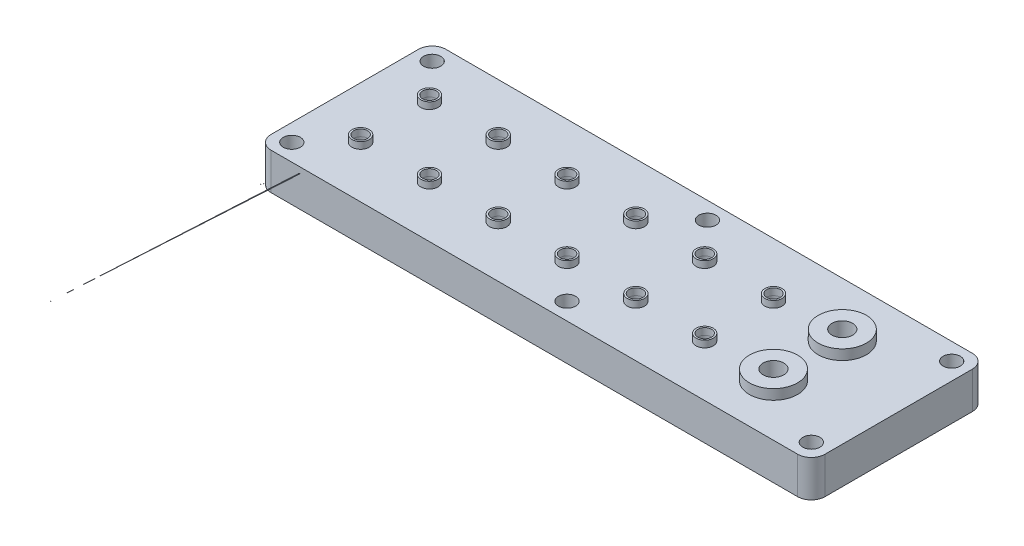
from build123d import *

# Parameters (mm, degrees)
SKETCH1_W                 = 161
SKETCH1_H                 = 50.8
BOSS_EXTRUDE1_DEPTH       = 10.7
CUT_EXTRUDE2_DEPTH        = 1.45
CUT_EXTRUDE2_DEPTH_BACK   = 170.163027875
SKETCH2_R                 = 2
CUT_EXTRUDE3_DEPTH        = 3.5
SKETCH4_R                 = 2.5
SKETCH4_R_2               = 6.99826734
SKETCH4_R_3               = 7
BOSS_EXTRUDE5_DEPTH       = 1.95
SKETCH6_R                 = 2
CUT_EXTRUDE5_DEPTH        = 1.95
CUT_EXTRUDE7_DEPTH        = 3.22
FILLET1_R                 = 4
F_5_0MM_DOWEL_HOLE1_D     = 5
SKETCH10_R                = 7
SKETCH10_R_2              = 6.99826734
BOSS_EXTRUDE6_DEPTH       = 1
F_6_0MM_DOWEL_HOLE1_D     = 6
F_6_0MM_DOWEL_HOLE1_DEPTH = 7
F_6_0MM_DOWEL_HOLE1_TIP   = 1.802581857


with BuildPart() as part:
    # Sketch1 → Boss-Extrude1 (new body)
    with BuildSketch(Plane(origin=(0, 0, 0), x_dir=(1, 0, 0), z_dir=(0, 1, 0))):
        with Locations((80.5, 25.4)):
            Rectangle(SKETCH1_W, SKETCH1_H)
    extrude(amount=BOSS_EXTRUDE1_DEPTH)

    # Sketch2 → Cut-Extrude2 (cut, two sides: drawn at the far end of the back side and taken through both)
    with BuildSketch(Plane(origin=(0, 10.7, 0), x_dir=(1, 0, 0), z_dir=(0, 1, 0)).offset(-CUT_EXTRUDE2_DEPTH_BACK)):
        with Locations((15, 15)):
            Circle(SKETCH2_R)
        with Locations((15, 35)):
            Circle(SKETCH2_R)
        with Locations((35, 15)):
            Circle(SKETCH2_R)
        with Locations((35, 35)):
            Circle(SKETCH2_R)
        with Locations((55, 35)):
            Circle(SKETCH2_R)
        with Locations((55, 15)):
            Circle(SKETCH2_R)
        with Locations((75, 35)):
            Circle(SKETCH2_R)
        with Locations((75, 15)):
            Circle(SKETCH2_R)
        with Locations((95, 35)):
            Circle(SKETCH2_R)
        with Locations((95, 15)):
            Circle(SKETCH2_R)
        with Locations((115, 35)):
            Circle(SKETCH2_R)
        with Locations((115, 15)):
            Circle(SKETCH2_R)
        with Locations((135, 35)):
            Circle(SKETCH2_R)
        with Locations((135, 15)):
            Circle(SKETCH2_R)
    extrude(amount=CUT_EXTRUDE2_DEPTH + CUT_EXTRUDE2_DEPTH_BACK, mode=Mode.SUBTRACT)

    # Sketch3 → Cut-Extrude3 (cut)
    with BuildSketch(Plane(origin=(0, 0, 0), x_dir=(-1, 0, 0), z_dir=(0, -1, 0))):
        with BuildLine():
            Line((-14.5, 12.5), (-135.5, 12.5))
            ThreePointArc((-135.5, 12.5), (-136.914213562, 13.085786438), (-137.5, 14.5))
            Line((-137.5, 14.5), (-137.5, 15.5))
            ThreePointArc((-137.5, 15.5), (-136.914213562, 16.914213562), (-135.5, 17.5))
            Line((-135.5, 17.5), (-14.5, 17.5))
            ThreePointArc((-14.5, 17.5), (-13.085786438, 16.914213562), (-12.5, 15.5))
            Line((-12.5, 15.5), (-12.5, 14.5))
            ThreePointArc((-12.5, 14.5), (-13.085786438, 13.085786438), (-14.5, 12.5))
        make_face()
        with BuildLine():
            Line((-14.5, 32.5), (-135.5, 32.5))
            ThreePointArc((-135.5, 32.5), (-136.914213562, 33.085786438), (-137.5, 34.5))
            Line((-137.5, 34.5), (-137.5, 35.5))
            ThreePointArc((-137.5, 35.5), (-136.914213562, 36.914213562), (-135.5, 37.5))
            Line((-135.5, 37.5), (-14.5, 37.5))
            ThreePointArc((-14.5, 37.5), (-13.085786438, 36.914213562), (-12.5, 35.5))
            Line((-12.5, 35.5), (-12.5, 34.5))
            ThreePointArc((-12.5, 34.5), (-13.085786438, 33.085786438), (-14.5, 32.5))
        make_face()
    extrude(amount=-CUT_EXTRUDE3_DEPTH, mode=Mode.SUBTRACT)

    # Sketch4 → Boss-Extrude5 (add)
    with BuildSketch(Plane(origin=(0, 10.7, 0), x_dir=(1, 0, 0), z_dir=(0, 1, 0))):
        with Locations((15, 35)):
            Circle(SKETCH4_R)
        with Locations((15, 15)):
            Circle(SKETCH4_R)
        with Locations((35, 35)):
            Circle(SKETCH4_R)
        with Locations((35, 15)):
            Circle(SKETCH4_R)
        with Locations((55, 35)):
            Circle(SKETCH4_R)
        with Locations((55, 15)):
            Circle(SKETCH4_R)
        with Locations((75, 35)):
            Circle(SKETCH4_R)
        with Locations((75, 15)):
            Circle(SKETCH4_R)
        with Locations((95, 35)):
            Circle(SKETCH4_R)
        with Locations((115, 15)):
            Circle(SKETCH4_R)
        with Locations((115, 35)):
            Circle(SKETCH4_R)
        with Locations((95, 15)):
            Circle(SKETCH4_R)
        with Locations((135, 15)):
            Circle(SKETCH4_R_2)
        with Locations((135, 35)):
            Circle(SKETCH4_R_3)
    extrude(amount=BOSS_EXTRUDE5_DEPTH)

    # Sketch6 → Cut-Extrude5 (cut)
    with BuildSketch(Plane(origin=(0, 12.65, 0), x_dir=(1, 0, 0), z_dir=(0, 1, 0))):
        with Locations((15.011898474, 14.996675956)):
            Circle(SKETCH6_R)
        with Locations((15.011898474, 34.996675956)):
            Circle(SKETCH6_R)
        with Locations((35.011898474, 14.996675956)):
            Circle(SKETCH6_R)
        with Locations((35.011898474, 34.996675956)):
            Circle(SKETCH6_R)
        with Locations((55.011898474, 34.996675956)):
            Circle(SKETCH6_R)
        with Locations((55.011898474, 14.996675956)):
            Circle(SKETCH6_R)
        with Locations((75.011898474, 34.996675956)):
            Circle(SKETCH6_R)
        with Locations((75.011898474, 14.996675956)):
            Circle(SKETCH6_R)
        with Locations((95.011898474, 34.996675956)):
            Circle(SKETCH6_R)
        with Locations((95.011898474, 14.996675956)):
            Circle(SKETCH6_R)
        with Locations((115.011898474, 34.996675956)):
            Circle(SKETCH6_R)
        with Locations((115.011898474, 14.996675956)):
            Circle(SKETCH6_R)
        with Locations((135.011898474, 34.996675956)):
            Circle(SKETCH6_R)
        with Locations((135.011898474, 14.996675956)):
            Circle(SKETCH6_R)
    extrude(amount=-CUT_EXTRUDE5_DEPTH, mode=Mode.SUBTRACT)

    # Sketch7 → Cut-Extrude7 (cut)
    with BuildSketch(Plane(origin=(0, 0, 0), x_dir=(-1, 0, 0), z_dir=(0, -1, 0))):
        with BuildLine():
            Line((-6.5, 6.75), (-154.5, 6.75))
            ThreePointArc((-154.5, 6.75), (-156.5, 8.75), (-154.5, 10.75))
            Line((-154.5, 10.75), (-6.5, 10.75))
            ThreePointArc((-6.5, 10.75), (-4.5, 8.75), (-6.5, 6.75))
        make_face()
        with BuildLine():
            Line((-8.5, 8.75), (-8.5, 21.25))
            ThreePointArc((-8.5, 21.25), (-6.5, 23.25), (-4.5, 21.25))
            Line((-4.5, 21.25), (-4.5, 8.75))
            ThreePointArc((-4.5, 8.75), (-6.5, 6.75), (-8.5, 8.75))
        make_face()
        with BuildLine():
            Line((-6.5, 19.25), (-154.5, 19.25))
            ThreePointArc((-154.5, 19.25), (-156.5, 21.25), (-154.5, 23.25))
            Line((-154.5, 23.25), (-6.5, 23.25))
            ThreePointArc((-6.5, 23.25), (-4.5, 21.25), (-6.5, 19.25))
        make_face()
        with BuildLine():
            Line((-152.5, 21.25), (-152.5, 8.75))
            ThreePointArc((-152.5, 8.75), (-154.5, 6.75), (-156.5, 8.75))
            Line((-156.5, 8.75), (-156.5, 21.25))
            ThreePointArc((-156.5, 21.25), (-154.5, 23.25), (-152.5, 21.25))
        make_face()
        with BuildLine():
            Line((-6.5, 26.75), (-154.5, 26.75))
            ThreePointArc((-154.5, 26.75), (-156.5, 28.75), (-154.5, 30.75))
            Line((-154.5, 30.75), (-6.5, 30.75))
            ThreePointArc((-6.5, 30.75), (-4.5, 28.75), (-6.5, 26.75))
        make_face()
        with BuildLine():
            Line((-8.5, 28.75), (-8.5, 41.25))
            ThreePointArc((-8.5, 41.25), (-6.5, 43.25), (-4.5, 41.25))
            Line((-4.5, 41.25), (-4.5, 28.75))
            ThreePointArc((-4.5, 28.75), (-6.5, 26.75), (-8.5, 28.75))
        make_face()
        with BuildLine():
            Line((-6.5, 39.25), (-154.5, 39.25))
            ThreePointArc((-154.5, 39.25), (-156.5, 41.25), (-154.5, 43.25))
            Line((-154.5, 43.25), (-6.5, 43.25))
            ThreePointArc((-6.5, 43.25), (-4.5, 41.25), (-6.5, 39.25))
        make_face()
        with BuildLine():
            Line((-152.5, 41.25), (-152.5, 28.75))
            ThreePointArc((-152.5, 28.75), (-154.5, 26.75), (-156.5, 28.75))
            Line((-156.5, 28.75), (-156.5, 41.25))
            ThreePointArc((-156.5, 41.25), (-154.5, 43.25), (-152.5, 41.25))
        make_face()
    extrude(amount=-CUT_EXTRUDE7_DEPTH, mode=Mode.SUBTRACT)

    # Fillet1
    fillet1_edges = [part.edges().sort_by_distance(p)[0] for p in [
        (161, 5.35, -50.8),
        (161, 5.35, 0),
        (0, 5.35, 0),
        (0, 5.35, -50.8),
    ]]
    fillet(fillet1_edges, radius=FILLET1_R)

    # Ø5.0mm Dowel Hole1 (through all)
    with Locations(Plane(origin=(0, 0, 0), x_dir=(-1, 0, 0), z_dir=(0, -1, 0))):
        with Locations((-5, 45.8), (-85, 45.8), (-156, 45.8), (-156, 5), (-85, 5), (-5, 5)):
            Hole(F_5_0MM_DOWEL_HOLE1_D / 2)

    # Sketch10 → Boss-Extrude6 (add)
    with BuildSketch(Plane(origin=(0, 12.65, 0), x_dir=(1, 0, 0), z_dir=(0, 1, 0))):
        with Locations((135, 35)):
            Circle(SKETCH10_R)
        with Locations((135, 15)):
            Circle(SKETCH10_R_2)
    extrude(amount=BOSS_EXTRUDE6_DEPTH)

    # Ø6.0mm Dowel Hole1
    with Locations(Plane(origin=(0, 13.65, 0), x_dir=(1, 0, 0), z_dir=(0, 1, 0))):
        with Locations((135, 35), (135, 15)):
            Hole(F_6_0MM_DOWEL_HOLE1_D / 2, depth=F_6_0MM_DOWEL_HOLE1_DEPTH)
            with Locations((0, 0, -(F_6_0MM_DOWEL_HOLE1_DEPTH + F_6_0MM_DOWEL_HOLE1_TIP / 2))):  # 118° drill point
                Cone(0, F_6_0MM_DOWEL_HOLE1_D / 2, F_6_0MM_DOWEL_HOLE1_TIP, mode=Mode.SUBTRACT)


solid = part.part
